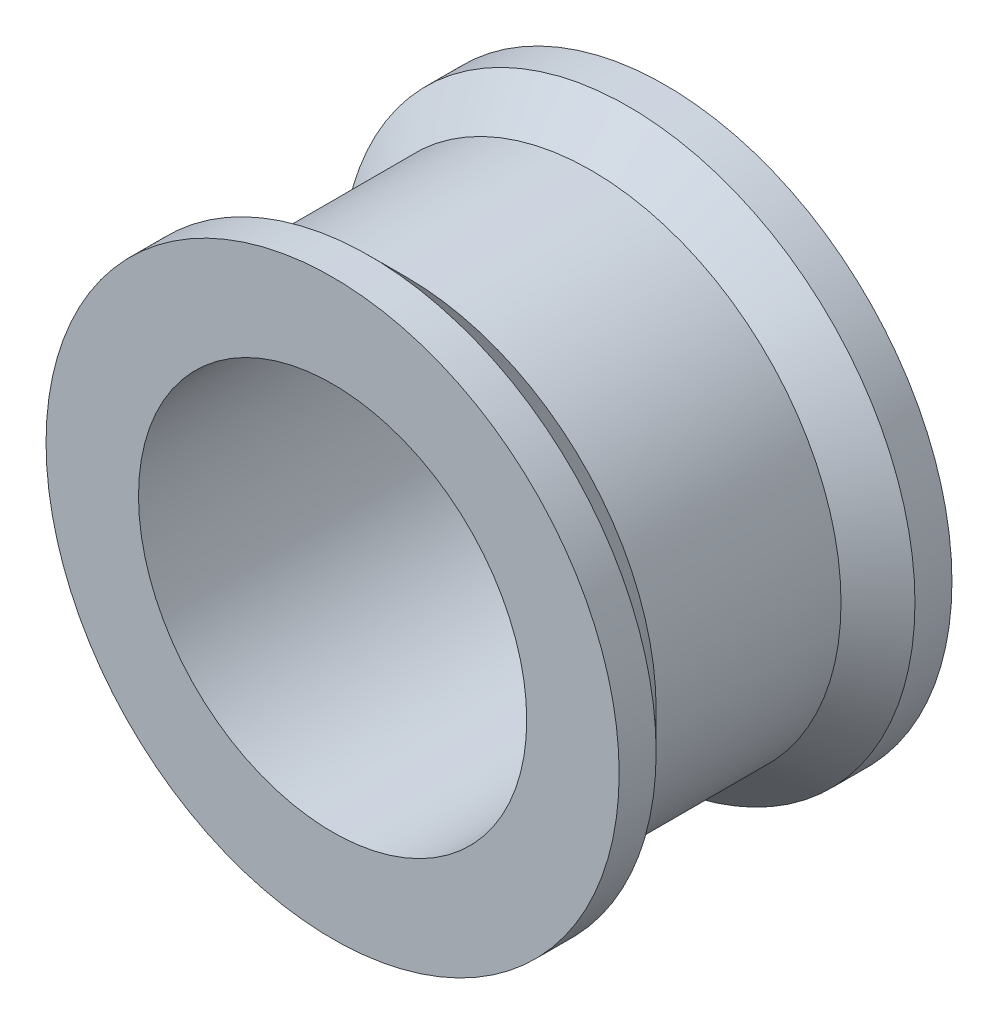
from build123d import *

# Parameters (mm, degrees)
SKETCH1_R           = 7.75
SKETCH1_R_2         = 5.25
BOSS_EXTRUDE1_DEPTH = 1
SKETCH2_R           = 6.75
SKETCH2_R_2         = 5.25
BOSS_EXTRUDE2_DEPTH = 3.5
CHAMFER1_SIZE       = 1


with BuildPart() as part:
    # Sketch1 → Boss-Extrude1 (new body)
    with BuildSketch(Plane.XY):
        Circle(SKETCH1_R)
        Circle(SKETCH1_R_2, mode=Mode.SUBTRACT)
    extrude(amount=BOSS_EXTRUDE1_DEPTH)

    # Sketch2 → Boss-Extrude2 (add)
    with BuildSketch(Plane.XY.offset(1)):
        Circle(SKETCH2_R)
        Circle(SKETCH2_R_2, mode=Mode.SUBTRACT)
    extrude(amount=BOSS_EXTRUDE2_DEPTH)

    # Chamfer1
    chamfer1_edges = [part.edges().sort_by_distance(p)[0] for p in [
        (-6.75, 0, 1),
    ]]
    chamfer(chamfer1_edges, length=CHAMFER1_SIZE - 0.0001)  # a hair under: the kernel refuses the full size

    # Mirror5: part across plane


with BuildPart() as part_1:
    add(part.part)
    add(part.part.mirror(Plane.XY.offset(4.5)))


solid = part_1.part
